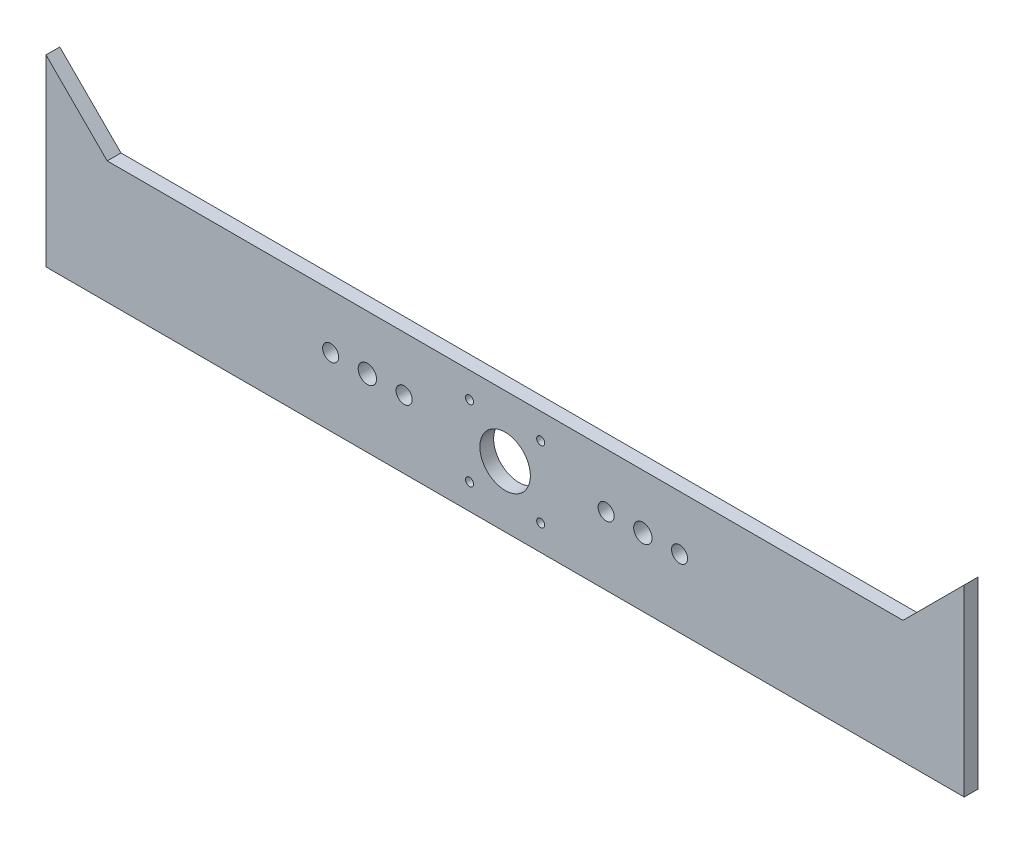
from build123d import *

# Parameters (mm, degrees)
BOSS_EXTRUDE1_DEPTH = 6
SKETCH2_R           = 11
SKETCH2_R_2         = 1.75
SKETCH2_R_3         = 4
SKETCH2_R_4         = 3.5
CUT_EXTRUDE1_DEPTH  = 216.490138986


with BuildPart() as part:
    # Sketch1 → Boss-Extrude1 (new body)
    with BuildSketch(Plane.XY):
        Polygon((-200, 0), (200, 0), (200, 80), (173.333333333, 53.333333333), (-173.333333333, 53.333333333), (-200, 80), align=None)
    extrude(amount=BOSS_EXTRUDE1_DEPTH)

    # Sketch2 → Cut-Extrude1 (cut, through all)
    with BuildSketch(Plane.XY.offset(6)):
        with Locations((0, 26.665)):
            Circle(SKETCH2_R)
        with Locations((15.5, 42.165)):
            Circle(SKETCH2_R_2)
        with Locations((-15.5, 42.165)):
            Circle(SKETCH2_R_2)
        with Locations((-15.5, 11.165)):
            Circle(SKETCH2_R_2)
        with Locations((15.5, 11.165)):
            Circle(SKETCH2_R_2)
        with Locations((60, 29.665)):
            Circle(SKETCH2_R_3)
        with Locations((76, 29.665)):
            Circle(SKETCH2_R_4)
        with Locations((44, 29.665)):
            Circle(SKETCH2_R_4)
        with Locations((-44, 29.665)):
            Circle(SKETCH2_R_4)
        with Locations((-76, 29.665)):
            Circle(SKETCH2_R_4)
        with Locations((-60, 29.665)):
            Circle(SKETCH2_R_3)
    extrude(amount=-CUT_EXTRUDE1_DEPTH, mode=Mode.SUBTRACT)


solid = part.part
